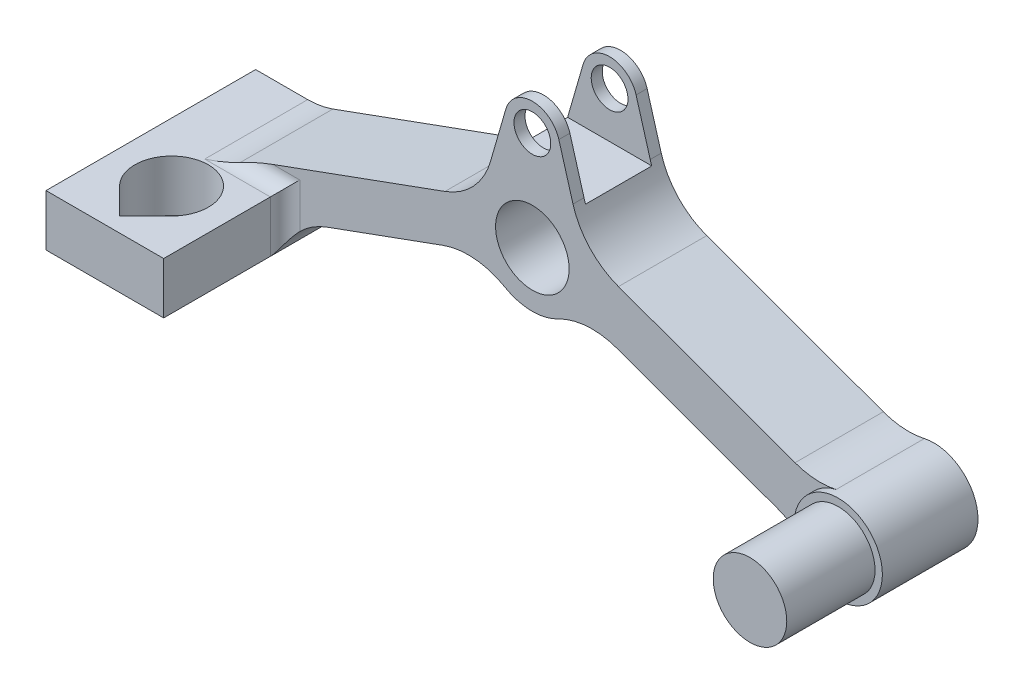
from build123d import *
from build123d.topology import SkipClean

# Parameters (mm, degrees)
CROQUIS1_R                 = 5
CROQUIS1_R_2               = 2.5
SALIENTE_EXTRUIR1_DEPTH    = 6
CORTAR_EXTRUIR1_DEPTH      = 20.743669872
CORTAR_EXTRUIR1_DEPTH_BACK = 20.743669872
CROQUIS3_W                 = 9
CROQUIS3_H                 = 14.204802578
CROQUIS4_W                 = 12
CROQUIS4_H                 = 6
SALIENTE_EXTRUIR2_DEPTH    = 38
CROQUIS8_W                 = 12
CROQUIS8_H                 = 7
SALIENTE_EXTRUIR5_DEPTH    = 39.5
CROQUIS9_R                 = 5
SALIENTE_EXTRUIR6_DEPTH    = 19
CROQUIS11_R                = 6
SALIENTE_EXTRUIR7_DEPTH    = 6
CROQUIS22_W                = 16
CROQUIS22_H                = 7
SALIENTE_EXTRUIR12_DEPTH   = 28.5
CORTAR_EXTRUIR3_DEPTH      = 17
REDONDEO1_R                = 10
REDONDEO2_R                = 10
REDONDEO3_R                = 2
CROQUIS25_R                = 6
SALIENTE_EXTRUIR13_DEPTH   = 1


with BuildPart() as part:
    # Croquis1 → Saliente-Extruir1 (new, symmetric)
    with BuildSketch(Plane.XY):
        with BuildLine():
            Line((-3.602420097, 14.541666667), (-7.204840194, 2.083333333))
            ThreePointArc((-7.204840194, 2.083333333), (0, -7.5), (7.204840194, 2.083333333))
            Line((7.204840194, 2.083333333), (3.602420097, 14.541666667))
            ThreePointArc((3.602420097, 14.541666667), (0, 17.25), (-3.602420097, 14.541666667))
        make_face()
        Circle(CROQUIS1_R, mode=Mode.SUBTRACT)
        with Locations((0, 13.5)):
            Circle(CROQUIS1_R_2, mode=Mode.SUBTRACT)
    extrude(amount=SALIENTE_EXTRUIR1_DEPTH, both=True)

    # Croquis3 → Cortar-Extruir1 (cut, two sides: drawn at the far end of the back side and taken through both)
    with BuildSketch(Plane(origin=(0, 0, 0), x_dir=(0, 0, -1), z_dir=(1, 0, 0)).offset(-CORTAR_EXTRUIR1_DEPTH_BACK)):
        with Locations((0, 14.352401289)):
            Rectangle(CROQUIS3_W, CROQUIS3_H)
    extrude(amount=CORTAR_EXTRUIR1_DEPTH + CORTAR_EXTRUIR1_DEPTH_BACK, mode=Mode.SUBTRACT)

    # Croquis4 → Saliente-Extruir2 (add)
    with BuildSketch(Plane(origin=(-41.624334392, -13.330167568, 0), x_dir=(0, 0, 1), z_dir=(-0.9396926207859082, -0.3420201433256695, 0))):
        Rectangle(CROQUIS4_W, CROQUIS4_H)
    extrude(amount=-SALIENTE_EXTRUIR2_DEPTH)

    # Croquis8 → Saliente-Extruir5 (add)
    with BuildSketch(Plane(origin=(42.587704831, -13.680805733, 0), x_dir=(0, 0, -1), z_dir=(0.9396926207859082, -0.34202014332566943, 0))):
        Rectangle(CROQUIS8_W, CROQUIS8_H)
    extrude(amount=-SALIENTE_EXTRUIR5_DEPTH)

    # Croquis9 → Saliente-Extruir6 (add)
    with BuildSketch(Plane.XY):
        with Locations(Location((42.587704831, -13.680805733, 0), (0, 0, 204.427004001))):
            Circle(CROQUIS9_R)
    extrude(amount=SALIENTE_EXTRUIR6_DEPTH)

    # Croquis11 → Saliente-Extruir7 (add, symmetric)
    with BuildSketch(Plane(origin=(0, 0, 0), x_dir=(-1, 0, 0), z_dir=(0, 0, -1))):
        with Locations((-42.587704831, -13.680805733)):
            Circle(CROQUIS11_R)
    extrude(amount=SALIENTE_EXTRUIR7_DEPTH, both=True)

    # Croquis22 → Saliente-Extruir12 (add)
    with BuildSketch(Plane(origin=(0, 0, -6), x_dir=(-1, 0, 0), z_dir=(0, 0, -1))):
        with Locations((41.624334392, -13.330167568)):
            Rectangle(CROQUIS22_W, CROQUIS22_H)
    extrude(amount=-SALIENTE_EXTRUIR12_DEPTH)

    # Croquis24 → Cortar-Extruir3 (cut)
    with BuildSketch(Plane.XZ.offset(16.830167568)):
        with BuildLine():
            Line((-41.624334392, 20.5), (-45.159868298, 16.964466094))
            ThreePointArc((-45.159868298, 16.964466094), (-41.624334392, 8.428932188), (-38.088800486, 16.964466094))
            Line((-38.088800486, 16.964466094), (-41.624334392, 20.5))
        make_face()
    extrude(amount=-CORTAR_EXTRUIR3_DEPTH, mode=Mode.SUBTRACT)

    # Redondeo1
    # the kernel refuses this fillet: 10 mm, written as the material it adds along each edge
    with BuildSketch(Plane(origin=(-6.501507493, -3.739037351, -6), x_dir=(-0.9396926207859082, -0.34202014332566955, 0), z_dir=(0, 0, 1))) as redondeo1_piece_1:
        with BuildLine():
            CenterArc((5.982924808, 10), REDONDEO1_R, 220.175955677, 49.824044323)
            ThreePointArc((-1.657743486, 3.548628981), (-0.593131346, 1.884440714), (0, 0))
            Line((0, 0), (5.982924808, 0))
        make_face()
    extrude(amount=12)
    with BuildSketch(Plane(origin=(6.231868861, -4.172985802, -6), x_dir=(-0.7440842561226181, -0.668085787747689, 0), z_dir=(0, 0, 1))) as redondeo1_piece_2:
        with BuildLine():
            CenterArc((6.16374333, 9.691301404), REDONDEO1_R, 208.080503653, 47.646059692)
            Line((-2.659127557, 4.984184526), (0, 0))
            ThreePointArc((0, 0), (1.849122999, 0.231523947), (3.698245998, 0))
        make_face()
    extrude(amount=12)
    with BuildSketch(Plane(origin=(6.933768131, 3.020788164, 6), x_dir=(0.9396926207859081, -0.34202014332566955, 0), z_dir=(0, 0, -1))) as redondeo1_piece_3_section:
        with BuildLine():
            CenterArc((REDONDEO1_R * 0.508123414429, -REDONDEO1_R), REDONDEO1_R, 90, 53.872379787)
            Line((-REDONDEO1_R * 0.299582345445, -REDONDEO1_R * 0.410414208562), (0, 0))
            Line((0, 0), (REDONDEO1_R * 0.508123414429, 0))
        make_face()
    redondeo1_piece_3 = extrude(amount=12, mode=Mode.PRIVATE)
    redondeo1_piece_3 = split(redondeo1_piece_3, bisect_by=Plane(origin=(7.707131888, 3.605094571, 4.5), z_dir=(0, 0, 1)), keep=Keep.TOP, mode=Mode.PRIVATE)
    redondeo1_piece_3 = split(redondeo1_piece_3, bisect_by=Plane(origin=(7.707131888, 7.25, 5.25), z_dir=(0, -1, 0)), keep=Keep.TOP, mode=Mode.PRIVATE)
    add(redondeo1_piece_3)
    with BuildSketch(Plane(origin=(6.933768131, 3.020788164, 6), x_dir=(0.9396926207859081, -0.34202014332566955, 0), z_dir=(0, 0, -1))) as redondeo1_piece_4_section:
        with BuildLine():
            CenterArc((REDONDEO1_R * 0.508123414429, -REDONDEO1_R), REDONDEO1_R, 90, 53.872379787)
            Line((-REDONDEO1_R * 0.299582345445, -REDONDEO1_R * 0.410414208562), (0, 0))
            Line((0, 0), (REDONDEO1_R * 0.508123414429, 0))
        make_face()
    redondeo1_piece_4 = extrude(amount=12, mode=Mode.PRIVATE)
    redondeo1_piece_4 = split(redondeo1_piece_4, bisect_by=Plane(origin=(5.523987689, 7.556477911, 4.5), z_dir=(0, 0, 1)), keep=Keep.TOP, mode=Mode.PRIVATE)
    redondeo1_piece_4 = split(redondeo1_piece_4, bisect_by=Plane(origin=(5.523987689, 7.25, 5.25), z_dir=(0, 1, 0)), keep=Keep.TOP, mode=Mode.PRIVATE)
    add(redondeo1_piece_4)
    with BuildSketch(Plane(origin=(6.933768131, 3.020788164, 6), x_dir=(0.9396926207859081, -0.34202014332566955, 0), z_dir=(0, 0, -1))) as redondeo1_piece_5_section:
        with BuildLine():
            CenterArc((REDONDEO1_R * 0.508123414429, -REDONDEO1_R), REDONDEO1_R, 90, 53.872379787)
            Line((-REDONDEO1_R * 0.299582345445, -REDONDEO1_R * 0.410414208562), (0, 0))
            Line((0, 0), (REDONDEO1_R * 0.508123414429, 0))
        make_face()
    redondeo1_piece_5 = extrude(amount=12, mode=Mode.PRIVATE)
    redondeo1_piece_5 = split(redondeo1_piece_5, bisect_by=Plane(origin=(7.707131888, 3.605094571, 4.5), z_dir=(0, 0, -1)), keep=Keep.TOP, mode=Mode.PRIVATE)
    redondeo1_piece_5 = split(redondeo1_piece_5, bisect_by=Plane(origin=(7.707131888, 7.25, 0), z_dir=(0, -1, 0)), keep=Keep.TOP, mode=Mode.PRIVATE)
    redondeo1_piece_5 = split(redondeo1_piece_5, bisect_by=Plane(origin=(7.707131888, 3.605094571, -4.5), z_dir=(0, 0, 1)), keep=Keep.TOP, mode=Mode.PRIVATE)
    add(redondeo1_piece_5)
    with BuildSketch(Plane(origin=(6.933768131, 3.020788164, 6), x_dir=(0.9396926207859081, -0.34202014332566955, 0), z_dir=(0, 0, -1))) as redondeo1_piece_6_section:
        with BuildLine():
            CenterArc((REDONDEO1_R * 0.508123414429, -REDONDEO1_R), REDONDEO1_R, 90, 53.872379787)
            Line((-REDONDEO1_R * 0.299582345445, -REDONDEO1_R * 0.410414208562), (0, 0))
            Line((0, 0), (REDONDEO1_R * 0.508123414429, 0))
        make_face()
    redondeo1_piece_6 = extrude(amount=12, mode=Mode.PRIVATE)
    redondeo1_piece_6 = split(redondeo1_piece_6, bisect_by=Plane(origin=(7.707131888, 7.25, -5.25), z_dir=(0, -1, 0)), keep=Keep.TOP, mode=Mode.PRIVATE)
    redondeo1_piece_6 = split(redondeo1_piece_6, bisect_by=Plane(origin=(7.707131888, 3.605094571, -4.5), z_dir=(0, 0, -1)), keep=Keep.TOP, mode=Mode.PRIVATE)
    add(redondeo1_piece_6)
    with BuildSketch(Plane(origin=(6.933768131, 3.020788164, 6), x_dir=(0.9396926207859081, -0.34202014332566955, 0), z_dir=(0, 0, -1))) as redondeo1_piece_7_section:
        with BuildLine():
            CenterArc((REDONDEO1_R * 0.508123414429, -REDONDEO1_R), REDONDEO1_R, 90, 53.872379787)
            Line((-REDONDEO1_R * 0.299582345445, -REDONDEO1_R * 0.410414208562), (0, 0))
            Line((0, 0), (REDONDEO1_R * 0.508123414429, 0))
        make_face()
    redondeo1_piece_7 = extrude(amount=12, mode=Mode.PRIVATE)
    redondeo1_piece_7 = split(redondeo1_piece_7, bisect_by=Plane(origin=(5.523987689, 7.25, -5.25), z_dir=(0, 1, 0)), keep=Keep.TOP, mode=Mode.PRIVATE)
    redondeo1_piece_7 = split(redondeo1_piece_7, bisect_by=Plane(origin=(5.523987689, 7.556477911, -4.5), z_dir=(0, 0, -1)), keep=Keep.TOP, mode=Mode.PRIVATE)
    add(redondeo1_piece_7)
    with BuildSketch(Plane(origin=(-7.105722939, 2.426112846, -6), x_dir=(0.2777777777777774, 0.9606453592105879, 0), z_dir=(0, 0, 1))) as redondeo1_piece_8_section:
        with BuildLine():
            CenterArc((REDONDEO1_R * 0.508123414429, REDONDEO1_R), REDONDEO1_R, 216.127620213, 53.872379787)
            Line((-REDONDEO1_R * 0.299582345445, REDONDEO1_R * 0.410414208562), (0, 0))
            Line((0, 0), (REDONDEO1_R * 0.508123414429, 0))
        make_face()
    redondeo1_piece_8 = extrude(amount=12, mode=Mode.PRIVATE)
    redondeo1_piece_8 = split(redondeo1_piece_8, bisect_by=Plane(origin=(-5.633833438, 7.269141523, -4.5), z_dir=(0, 0, -1)), keep=Keep.TOP, mode=Mode.PRIVATE)
    redondeo1_piece_8 = split(redondeo1_piece_8, bisect_by=Plane(origin=(-5.633833438, 7.25, -5.25), z_dir=(0, 1, 0)), keep=Keep.TOP, mode=Mode.PRIVATE)
    add(redondeo1_piece_8)
    with BuildSketch(Plane(origin=(-7.105722939, 2.426112846, -6), x_dir=(0.2777777777777774, 0.9606453592105879, 0), z_dir=(0, 0, 1))) as redondeo1_piece_9_section:
        with BuildLine():
            CenterArc((REDONDEO1_R * 0.508123414429, REDONDEO1_R), REDONDEO1_R, 216.127620213, 53.872379787)
            Line((-REDONDEO1_R * 0.299582345445, REDONDEO1_R * 0.410414208562), (0, 0))
            Line((0, 0), (REDONDEO1_R * 0.508123414429, 0))
        make_face()
    redondeo1_piece_9 = extrude(amount=12, mode=Mode.PRIVATE)
    redondeo1_piece_9 = split(redondeo1_piece_9, bisect_by=Plane(origin=(-7.830945447, 3.097346967, -4.5), z_dir=(0, 0, -1)), keep=Keep.TOP, mode=Mode.PRIVATE)
    redondeo1_piece_9 = split(redondeo1_piece_9, bisect_by=Plane(origin=(-7.830945447, 7.25, -5.25), z_dir=(0, -1, 0)), keep=Keep.TOP, mode=Mode.PRIVATE)
    add(redondeo1_piece_9)
    with BuildSketch(Plane(origin=(-7.105722939, 2.426112846, -6), x_dir=(0.2777777777777774, 0.9606453592105879, 0), z_dir=(0, 0, 1))) as redondeo1_piece_10_section:
        with BuildLine():
            CenterArc((REDONDEO1_R * 0.508123414429, REDONDEO1_R), REDONDEO1_R, 216.127620213, 53.872379787)
            Line((-REDONDEO1_R * 0.299582345445, REDONDEO1_R * 0.410414208562), (0, 0))
            Line((0, 0), (REDONDEO1_R * 0.508123414429, 0))
        make_face()
    redondeo1_piece_10 = extrude(amount=12, mode=Mode.PRIVATE)
    redondeo1_piece_10 = split(redondeo1_piece_10, bisect_by=Plane(origin=(-7.830945447, 3.097346967, -4.5), z_dir=(0, 0, 1)), keep=Keep.TOP, mode=Mode.PRIVATE)
    redondeo1_piece_10 = split(redondeo1_piece_10, bisect_by=Plane(origin=(-7.830945447, 7.25, 0), z_dir=(0, -1, 0)), keep=Keep.TOP, mode=Mode.PRIVATE)
    redondeo1_piece_10 = split(redondeo1_piece_10, bisect_by=Plane(origin=(-7.830945447, 3.097346967, 4.5), z_dir=(0, 0, -1)), keep=Keep.TOP, mode=Mode.PRIVATE)
    add(redondeo1_piece_10)
    with BuildSketch(Plane(origin=(-7.105722939, 2.426112846, -6), x_dir=(0.2777777777777774, 0.9606453592105879, 0), z_dir=(0, 0, 1))) as redondeo1_piece_11_section:
        with BuildLine():
            CenterArc((REDONDEO1_R * 0.508123414429, REDONDEO1_R), REDONDEO1_R, 216.127620213, 53.872379787)
            Line((-REDONDEO1_R * 0.299582345445, REDONDEO1_R * 0.410414208562), (0, 0))
            Line((0, 0), (REDONDEO1_R * 0.508123414429, 0))
        make_face()
    redondeo1_piece_11 = extrude(amount=12, mode=Mode.PRIVATE)
    redondeo1_piece_11 = split(redondeo1_piece_11, bisect_by=Plane(origin=(-5.633833438, 7.25, 5.25), z_dir=(0, 1, 0)), keep=Keep.TOP, mode=Mode.PRIVATE)
    redondeo1_piece_11 = split(redondeo1_piece_11, bisect_by=Plane(origin=(-5.633833438, 7.269141523, 4.5), z_dir=(0, 0, 1)), keep=Keep.TOP, mode=Mode.PRIVATE)
    add(redondeo1_piece_11)
    with BuildSketch(Plane(origin=(-7.105722939, 2.426112846, -6), x_dir=(0.2777777777777774, 0.9606453592105879, 0), z_dir=(0, 0, 1))) as redondeo1_piece_12_section:
        with BuildLine():
            CenterArc((REDONDEO1_R * 0.508123414429, REDONDEO1_R), REDONDEO1_R, 216.127620213, 53.872379787)
            Line((-REDONDEO1_R * 0.299582345445, REDONDEO1_R * 0.410414208562), (0, 0))
            Line((0, 0), (REDONDEO1_R * 0.508123414429, 0))
        make_face()
    redondeo1_piece_12 = extrude(amount=12, mode=Mode.PRIVATE)
    redondeo1_piece_12 = split(redondeo1_piece_12, bisect_by=Plane(origin=(-7.830945447, 7.25, 5.25), z_dir=(0, -1, 0)), keep=Keep.TOP, mode=Mode.PRIVATE)
    redondeo1_piece_12 = split(redondeo1_piece_12, bisect_by=Plane(origin=(-7.830945447, 3.097346967, 4.5), z_dir=(0, 0, 1)), keep=Keep.TOP, mode=Mode.PRIVATE)
    add(redondeo1_piece_12)

    # Redondeo2
    # the kernel refuses this fillet: 10 mm, written as the material it adds along each edge
    with BuildSketch(Plane(origin=(-33.624334392, -13.610939012, 6), x_dir=(0, -1, 0), z_dir=(0, 0, -1))) as redondeo2_piece_1:
        with BuildLine():
            CenterArc((7.32261171, -9.119333676), REDONDEO2_R, 114.226089014, 45.773910986)
            Line((-2.074314498, -5.699132243), (-2.262253022, -5.630728214))
            Line((-2.262253022, -5.630728214), (-0.187938524, 0.068404029))
            Line((-0.187938524, 0.068404029), (0, 0.2))
            ThreePointArc((0, 0.2), (1.609614278, 0.2), (3.137160894, 0.182386674))
            Line((3.137160894, 0.182386674), (3.219228557, 0))
        make_face()
    extrude(amount=12)
    with BuildSketch(Plane(origin=(-40.779576624, -9.830167568, -6), x_dir=(0.9396926207859088, 0.3420201433256678, 0), z_dir=(0, 0, 1))) as redondeo2_piece_2:
        with BuildLine():
            CenterArc((REDONDEO2_R * 0.176326980708, REDONDEO2_R), REDONDEO2_R, 250, 20)
            Line((-REDONDEO2_R * 0.165693162617, REDONDEO2_R * 0.0603073792141), (-REDONDEO2_R * 0.172533565484, REDONDEO2_R * 0.0415135267984))
            Line((-REDONDEO2_R * 0.172533565484, REDONDEO2_R * 0.0415135267984), (-REDONDEO2_R * 0.00352653961417, -REDONDEO2_R * 0.02))
            Line((-REDONDEO2_R * 0.00352653961417, -REDONDEO2_R * 0.02), (REDONDEO2_R * 0.176326980708, -REDONDEO2_R * 0.02))
            Line((REDONDEO2_R * 0.176326980708, -REDONDEO2_R * 0.02), (REDONDEO2_R * 0.176326980708, 0))
        make_face()
    extrude(amount=12)
    with BuildSketch(Plane(origin=(36.811138969, -15.302929906, 6), x_dir=(-0.9396926207859084, 0.3420201433256687, 0), z_dir=(0, 0, -1))) as redondeo2_piece_3:
        with BuildLine():
            CenterArc((3.714384846, -10), REDONDEO2_R, 90, 32.461744967)
            Line((-1.652978915, -1.5625), (-1.760326191, -1.39375))
            ThreePointArc((-1.760326191, -1.39375), (-0.889157213, -0.714953374), (-0.162446572, 0.116666667))
            Line((-0.162446572, 0.116666667), (0, 0.2))
            Line((0, 0.2), (3.714384846, 0.2))
            Line((3.714384846, 0.2), (3.714384846, 0))
        make_face()
    extrude(amount=12)
    with BuildSketch(Plane(origin=(39.205279972, -8.725081561, 6), x_dir=(0.917836362849066, 0.39695895383779634, 0), z_dir=(0, 0, -1))) as redondeo2_piece_4:
        with BuildLine():
            CenterArc((4.170075975, -9.818712805), REDONDEO2_R, 100.92646016, 32.461744967)
            Line((-2.699303266, -2.551551815), (-2.83669085, -2.406208596))
            Line((-2.83669085, -2.406208596), (-0.137387585, 0.14534322))
            Line((-0.137387585, 0.14534322), (0.037909782, 0.196374256))
            ThreePointArc((0.037909782, 0.196374256), (1.137293448, 0.091227683), (2.236677114, 0.196374256))
            Line((2.236677114, 0.196374256), (2.274586895, 0))
        make_face()
    extrude(amount=12)

    # Redondeo3
    redondeo3_edges = [part.edges().sort_by_distance(p)[0] for p in [
        (-33.624334392, -13.330167568, 6),
        (-38.083590411, -9.830167568, 6),
    ]]
    fillet(redondeo3_edges, radius=REDONDEO3_R)

    # Croquis25 → Saliente-Extruir13 (add)
    with SkipClean():  # the faces are left unmerged after this step: merging them gives an invalid solid
        with BuildSketch(Plane.XY.offset(6)):
            with Locations((42.587704831, -13.680805733)):
                Circle(CROQUIS25_R)
        extrude(amount=SALIENTE_EXTRUIR13_DEPTH)


solid = part.part
